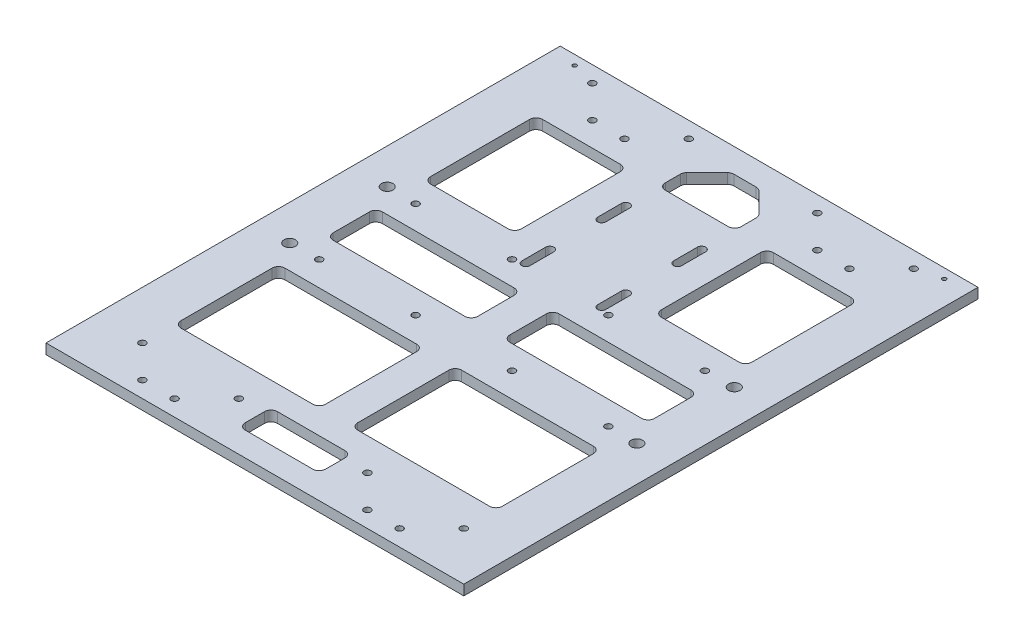
from build123d import *

# Parameters (mm, degrees)
SKETCH1_W                           = 240
SKETCH1_H                           = 320
BOSS_EXTRUDE1_DEPTH                 = 6.35
F_7_1_7_1_DIAMETER_HOLE1_D          = 7.1
M5X0_8_TAPPED_HOLE1_D               = 4.2
M5X0_8_TAPPED_HOLE3_D               = 4.2
F_5_0MM_CLEARANCE_DOWEL_SLOT1_DEPTH = 6.35
SKETCH12_W                          = 25
SKETCH12_H                          = 20
SKETCH12_W_2                        = 90
SKETCH12_H_2                        = 64.68
SKETCH12_W_3                        = 56.4
SKETCH12_H_3                        = 69.68
SKETCH12_W_4                        = 23.6
SKETCH12_H_4                        = 15
SKETCH12_H_5                        = 30.64
CUT_EXTRUDE1_DEPTH                  = 10
FILLET1_R                           = 4
FILLET1_OF_MIRROR1_R                = 4
SKETCH13_W                          = 10
SKETCH13_H                          = 320
BOSS_EXTRUDE2_DEPTH                 = 6.35
M3X0_5_TAPPED_HOLE1_D               = 2.5


# Read off the part's stored shape, not the designer's step: Ø5.0mm Clearance Dowel Slot1
with BuildPart() as part:
    # Sketch1 → Boss-Extrude1 (new body)
    with BuildSketch(Plane(origin=(0, 0, 0), x_dir=(1, 0, 0), z_dir=(0, 1, 0))):
        Rectangle(SKETCH1_W, SKETCH1_H)
    extrude(amount=BOSS_EXTRUDE1_DEPTH)

    # Ø7.1 (7.1) Diameter Hole1 (through all)
    with Locations(Plane(origin=(0, 6.35, 0), x_dir=(1, 0, 0), z_dir=(0, 1, 0))):
        with Locations((-108, 30.32), (108, 30.32), (108, -30.32), (-108, -30.32)):
            Hole(F_7_1_7_1_DIAMETER_HOLE1_D / 2)

    # M5x0.8 Tapped Hole1 (through all)
    with Locations(Plane(origin=(0, 6.35, 0), x_dir=(1, 0, 0), z_dir=(0, 1, 0))):
        with Locations((-90, 30), (-30, 30), (30, 30), (90, 30), (-90, -30), (-30, -30), (30, -30), (90, -30)):
            Hole(M5X0_8_TAPPED_HOLE1_D / 2)

    # M5x0.8 Tapped Hole3 (through all)
    with Locations(Plane(origin=(0, 6.35, 0), x_dir=(1, 0, 0), z_dir=(0, 1, 0))):
        with Locations((-80, -150), (-60, -150), (-40, -130), (-100, -130), (-100, 150), (-80, 130), (-60, 130), (-40, 150), (40, 150), (60, 130), (80, 130), (100, 150), (40, -130), (100, -130), (60, -150), (80, -150)):
            Hole(M5X0_8_TAPPED_HOLE3_D / 2)

    # Ø5.0mm Clearance Dowel Slot1 outline → Ø5.0mm Clearance Dowel Slot1 (cut)
    with BuildSketch(Plane(origin=(0, 0, 0), x_dir=(1, 0, 0), z_dir=(0, 1, 0))):
        with BuildLine():
            Line((26.15, 32.23), (26.15, 47.13))
            ThreePointArc((26.15, 47.13), (23.6, 49.68), (21.05, 47.13))
            Line((21.05, 47.13), (21.05, 32.23))
            ThreePointArc((21.05, 32.23), (23.6, 29.68), (26.15, 32.23))
        make_face()
        with BuildLine():
            ThreePointArc((26.15, 94.33), (23.6, 96.88), (21.05, 94.33))
            Line((21.05, 94.33), (21.05, 79.43))
            ThreePointArc((21.05, 79.43), (23.6, 76.88), (26.15, 79.43))
            Line((26.15, 79.43), (26.15, 94.33))
        make_face()
        with BuildLine():
            Line((-21.05, 32.23), (-21.05, 47.13))
            ThreePointArc((-21.05, 47.13), (-23.6, 49.68), (-26.15, 47.13))
            Line((-26.15, 47.13), (-26.15, 32.23))
            ThreePointArc((-26.15, 32.23), (-23.6, 29.68), (-21.05, 32.23))
        make_face()
        with BuildLine():
            ThreePointArc((-21.05, 94.33), (-23.6, 96.88), (-26.15, 94.33))
            Line((-26.15, 94.33), (-26.15, 79.43))
            ThreePointArc((-26.15, 79.43), (-23.6, 76.88), (-21.05, 79.43))
            Line((-21.05, 79.43), (-21.05, 94.33))
        make_face()
    extrude(amount=F_5_0MM_CLEARANCE_DOWEL_SLOT1_DEPTH, mode=Mode.SUBTRACT)

    # Sketch12 → Cut-Extrude1 (cut)
    with BuildSketch(Plane(origin=(0, 6.35, 0), x_dir=(1, 0, 0), z_dir=(0, 1, 0))):
        with Locations((-12.5, -135)):
            Rectangle(SKETCH12_W, SKETCH12_H)
        with Locations((-55, -77.66)):
            Rectangle(SKETCH12_W_2, SKETCH12_H_2)
        with Locations((-71.8, 80.16)):
            Rectangle(SKETCH12_W_3, SKETCH12_H_3)
        with Locations((-11.8, 122.5)):
            Rectangle(SKETCH12_W_4, SKETCH12_H_4)
        Polygon((0, 130), (-23.6, 130), (-8.6, 145), (0, 145), align=None)
        with Locations((-55, 0)):
            Rectangle(SKETCH12_W_2, SKETCH12_H_5)
    cut_extrude1 = extrude(amount=-CUT_EXTRUDE1_DEPTH, mode=Mode.SUBTRACT)

    # Fillet1
    fillet1_edges = [part.edges().sort_by_distance(p)[0] for p in [
        (-25, 3.175, 125),
        (-25, 3.175, 145),
        (-10, 3.175, 45.32),
        (-10, 3.175, 110),
        (-100, 3.175, 110),
        (-100, 3.175, 45.32),
        (-43.6, 3.175, -115),
        (-43.6, 3.175, -45.32),
        (-100, 3.175, -45.32),
        (-100, 3.175, -115),
        (-23.6, 3.175, -115),
        (-23.6, 3.175, -130),
        (-8.6, 3.175, -145),
        (-100, 3.175, 15.32),
        (-100, 3.175, -15.32),
        (-10, 3.175, -15.32),
        (-10, 3.175, 15.32),
    ]]
    fillet(fillet1_edges, radius=FILLET1_R)

    # Mirror1: Cut-Extrude1 across plane
    add(cut_extrude1.mirror(Plane.ZY), mode=Mode.SUBTRACT)

    # Fillet1 of Mirror1
    fillet1_of_mirror1_edges = [part.edges().sort_by_distance(p)[0] for p in [
        (25, 3.175, 125),
        (25, 3.175, 145),
        (10, 3.175, 45.32),
        (10, 3.175, 110),
        (100, 3.175, 110),
        (100, 3.175, 45.32),
        (43.6, 3.175, -115),
        (43.6, 3.175, -45.32),
        (100, 3.175, -45.32),
        (100, 3.175, -115),
        (23.6, 3.175, -115),
        (23.6, 3.175, -130),
        (8.6, 3.175, -145),
        (100, 3.175, 15.32),
        (100, 3.175, -15.32),
        (10, 3.175, -15.32),
        (10, 3.175, 15.32),
    ]]
    fillet(fillet1_of_mirror1_edges, radius=FILLET1_OF_MIRROR1_R)

    # Sketch13 → Boss-Extrude2 (add)
    with BuildSketch(Plane(origin=(0, 6.35, 0), x_dir=(1, 0, 0), z_dir=(0, 1, 0))):
        with Locations((-125, 0)):
            Rectangle(SKETCH13_W, SKETCH13_H)
        with Locations((125, 0)):
            Rectangle(SKETCH13_W, SKETCH13_H)
    extrude(amount=-BOSS_EXTRUDE2_DEPTH)

    # M3x0.5 Tapped Hole1 (through all)
    with Locations(Plane(origin=(0, 0, 0), x_dir=(-1, 0, 0), z_dir=(0, -1, 0))):
        with Locations((-115, 154), (115, 154)):
            Hole(M3X0_5_TAPPED_HOLE1_D / 2)


solid = part.part
